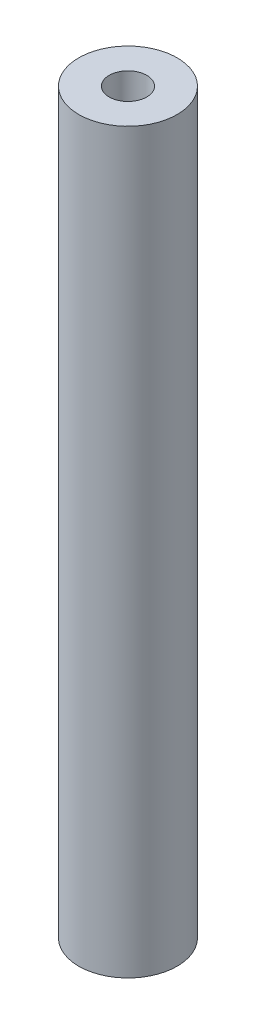
from build123d import *

# Parameters (mm, degrees)
SKETCH1_R           = 2
SKETCH1_R_2         = 0.765
BOSS_EXTRUDE1_DEPTH = 15


with BuildPart() as part:
    # Sketch1 → Boss-Extrude1 (new, symmetric)
    with BuildSketch(Plane(origin=(0, 0, 0), x_dir=(1, 0, 0), z_dir=(0, 1, 0))):
        Circle(SKETCH1_R)
        Circle(SKETCH1_R_2, mode=Mode.SUBTRACT)
    extrude(amount=BOSS_EXTRUDE1_DEPTH, both=True)


solid = part.part
